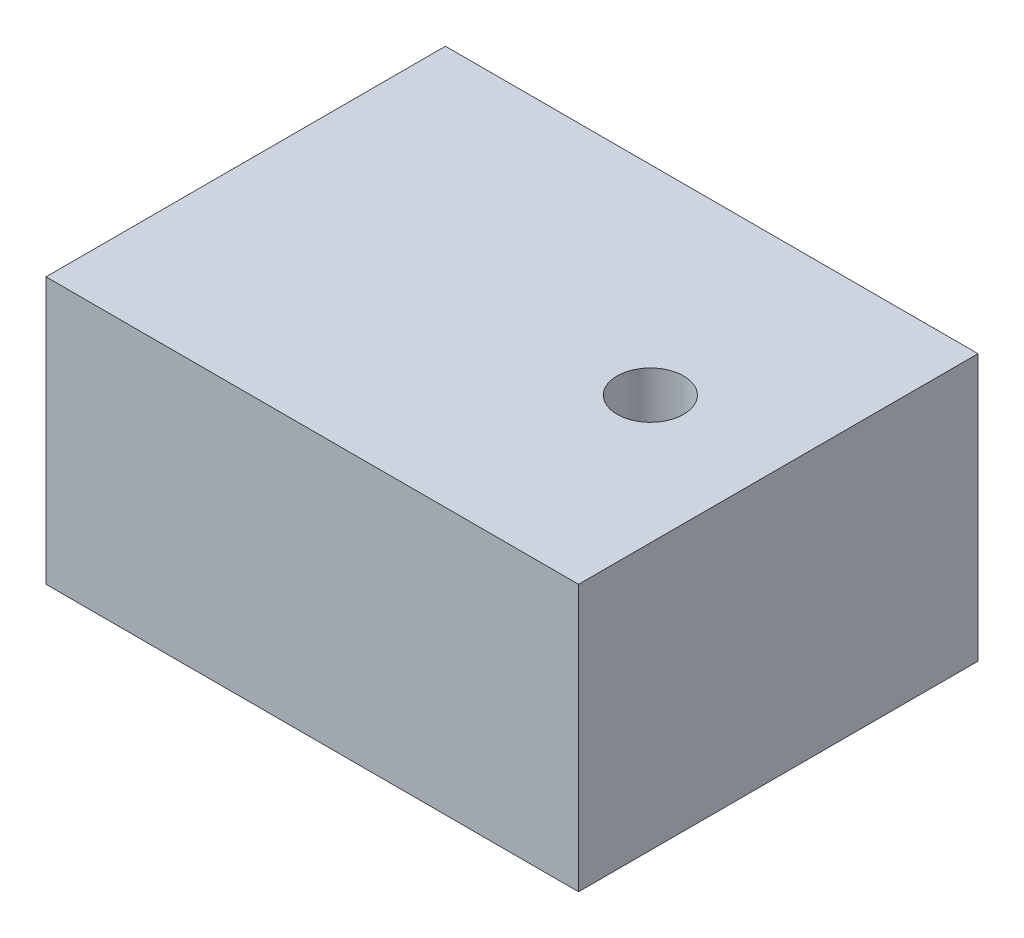
from build123d import *

# Parameters (mm, degrees)
SKETCH1_W           = 50.8
SKETCH1_H           = 38.1
BOSS_EXTRUDE1_DEPTH = 25.4
SKETCH2_R           = 3.175
CUT_EXTRUDE1_DEPTH  = 69.391593051
SKETCH3_R           = 4.7625
CUT_EXTRUDE2_DEPTH  = 19.05


with BuildPart() as part:
    # Sketch1 → Boss-Extrude1 (new body)
    with BuildSketch(Plane(origin=(0, 0, 0), x_dir=(1, 0, 0), z_dir=(0, 1, 0))):
        with Locations((25.4, 19.05)):
            Rectangle(SKETCH1_W, SKETCH1_H)
    extrude(amount=BOSS_EXTRUDE1_DEPTH)

    # Sketch2 → Cut-Extrude1 (cut, through all)
    with BuildSketch(Plane(origin=(0, 25.4, 0), x_dir=(1, 0, 0), z_dir=(0, 1, 0))):
        with Locations((38.596627058, 19.05)):
            Circle(SKETCH2_R)
    extrude(amount=-CUT_EXTRUDE1_DEPTH, mode=Mode.SUBTRACT)

    # Sketch3 → Cut-Extrude2 (cut)
    with BuildSketch(Plane.ZY):
        with Locations((-19.05, 12.7)):
            Circle(SKETCH3_R)
    extrude(amount=-CUT_EXTRUDE2_DEPTH, mode=Mode.SUBTRACT)


solid = part.part
